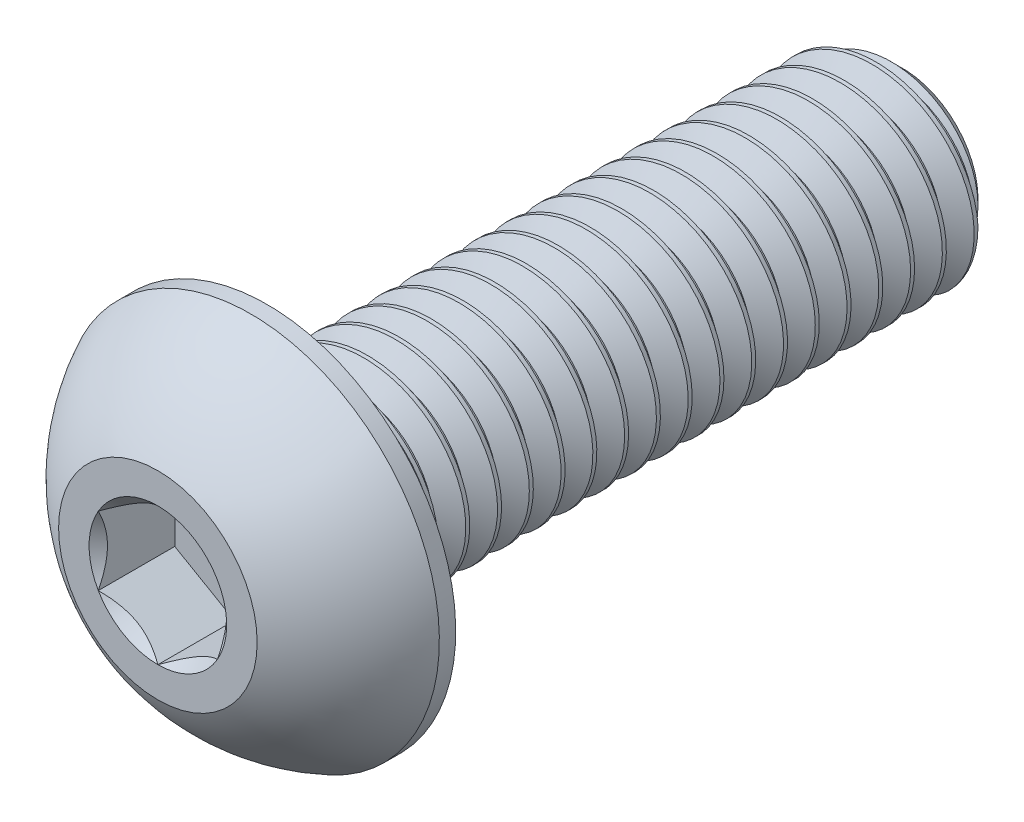
from build123d import *

# Parameters (mm, degrees)
CUT_EXTRUDE2_DEPTH = 1.925
CUT_SWEEP2_PITCH   = 0.8
CUT_SWEEP2_TO      = 16


with BuildPart() as part:
    # Sketch10 → Revolve3 (revolve)
    with BuildSketch(Plane(origin=(0, 0, 0), x_dir=(0, 0, -1), z_dir=(1, 0, 0)), mode=Mode.PRIVATE) as revolve3_sk:
        Polygon((7.4, 2.5), (8, 1.9), (8, 0), (-8, 0), (-8, 2.5), align=None)
    revolve(revolve3_sk.sketch.rotate(Axis((0, 0, 10.75), (0, 0, -1)), 180), axis=Axis((0, 0, 10.75), (0, 0, -1)))

    # Sketch7 → Revolve2 (revolve)
    with BuildSketch(Plane(origin=(0, 0, 0), x_dir=(0, 0, -1), z_dir=(1, 0, 0)), mode=Mode.PRIVATE) as revolve2_sk:
        with BuildLine():
            Line((-8.4125, 4.75), (-8, 4.75))
            Line((-8, 4.75), (-8, 0))
            Line((-8, 0), (-10.75, 0))
            Line((-10.75, 0), (-10.75, 2.5))
            ThreePointArc((-10.75, 2.5), (-9.758124817, 3.808753282), (-8.4125, 4.75))
        make_face()
    revolve(revolve2_sk.sketch.rotate(Axis((0, 0, 10.75), (0, 0, -1)), 180), axis=Axis((0, 0, 10.75), (0, 0, -1)))

    # Sketch5 → Cut-Extrude2 (cut)
    with BuildSketch(Plane.XY.offset(10.75)):
        Polygon((1.5, -0.866025404), (1.5, 0.866025404), (0, 1.732050808), (-1.5, 0.866025404), (-1.5, -0.866025404), (0, -1.732050808), align=None)
    extrude(amount=-CUT_EXTRUDE2_DEPTH, mode=Mode.SUBTRACT)

    # Cut-Extrude3 cone 1 section (through the dimple's axis) → Cut-Extrude3 (revolve, cut)
    with BuildSketch(Plane(origin=(0, 0, 10.75), x_dir=(0, -1, 0), z_dir=(1, 0, 0))):
        Polygon((0, 0), (1.732050808, 0), (0, 1.732050808), align=None)
    revolve(axis=Axis((0, 0, 10.75), (0, 0, -1)), mode=Mode.SUBTRACT)


with BuildPart() as body_2:
    # Split1: read off the stored shape, not the designer's step
    # Split1: the piece on the far side of the plane
    add(part.part)
    split(bisect_by=Plane.XY.offset(8), keep=Keep.BOTTOM)

    # Cut-Sweep2: arcs per turn and ends read off the stored shape
    # Cut-Sweep2: the profile of Sketch12 screwed along a right-hand helix through 25 turns, 8 arcs to a turn; built about Z, then put on its axis
    cut_sweep2_z = Axis((0, 0, 0), (0, 0, 1))
    cut_sweep2_corners = [(1.980384758, 0, -0.3), (1.980384758, 0, -0.4), (2.54330127, 0, -0.725), (2.54330127, 0, 0.025)]
    with BuildLine(mode=Mode.PRIVATE) as cut_sweep2_profile:
        Line(cut_sweep2_corners[0], cut_sweep2_corners[1])
        Line(cut_sweep2_corners[1], cut_sweep2_corners[2])
        Line(cut_sweep2_corners[2], cut_sweep2_corners[3])
        Line(cut_sweep2_corners[3], cut_sweep2_corners[0])
    cut_sweep2_cap = Face(cut_sweep2_profile.wire())
    cut_sweep2_turn_angles = [0, 22.5, 45, 67.5, 90, 112.5, 135, 157.5, 180, 202.5, 225, 247.5, 270, 292.5, 315, 337.5, 360]
    cut_sweep2_turn_weights = [1, 0.9238795325112867, 1, 0.9238795325112867, 1, 0.9238795325112867, 1, 0.9238795325112867, 1, 0.9238795325112867, 1, 0.9238795325112867, 1, 0.9238795325112867, 1, 0.9238795325112867, 1]
    cut_sweep2_turn_rails = [Edge.make_bspline([Vector(p[0], p[1], 0).rotate(cut_sweep2_z, cut_sweep2_turn_angles[k]) / cut_sweep2_turn_weights[k] + Vector(0, 0, p[2] + CUT_SWEEP2_PITCH * cut_sweep2_turn_angles[k] / 360) for k in range(17)], [0, 0, 0, 1, 1, 2, 2, 3, 3, 4, 4, 5, 5, 6, 6, 7, 7, 8, 8, 8], 2, cut_sweep2_turn_weights) for p in cut_sweep2_corners]
    cut_sweep2_turn_sides = [Face.make_surface_from_curves(cut_sweep2_turn_rails[p[0]], cut_sweep2_turn_rails[p[1]]) for p in [(0, 1), (1, 2), (2, 3), (3, 0)]]
    cut_sweep2 = Plane(origin=(0, 0, -8), x_dir=(0, 1, 0), z_dir=(0, 0, 1)) * split(Solid(Shell([*[p.moved(Location((0, 0, CUT_SWEEP2_PITCH * i))) for i in range(25) for p in cut_sweep2_turn_sides], cut_sweep2_cap, cut_sweep2_cap.rotate(cut_sweep2_z, 9000).moved(Location((0, 0, CUT_SWEEP2_PITCH * 9000 / 360)))])), bisect_by=Plane.XY.offset(CUT_SWEEP2_TO), keep=Keep.BOTTOM, mode=Mode.PRIVATE)
    add(cut_sweep2, mode=Mode.SUBTRACT)


with BuildPart() as part_1:
    add(part.part)

    # Split1
    split(bisect_by=Plane.XY.offset(8), keep=Keep.TOP)

    add(body_2.part)  # Boss-Extrude1 merges body 2
    # Boss-Extrude1: read off the stored shape, not the designer's step
    # Boss-Extrude1 outline → Boss-Extrude1 (revolve)
    with BuildSketch(Plane.XZ):
        Polygon((1.980384758, 8), (1.980384758, 7.480384758), (2.5, 8), align=None)
    revolve(axis=Axis((0, 0, 0), (0, 0, 1)))


solid = part_1.part
